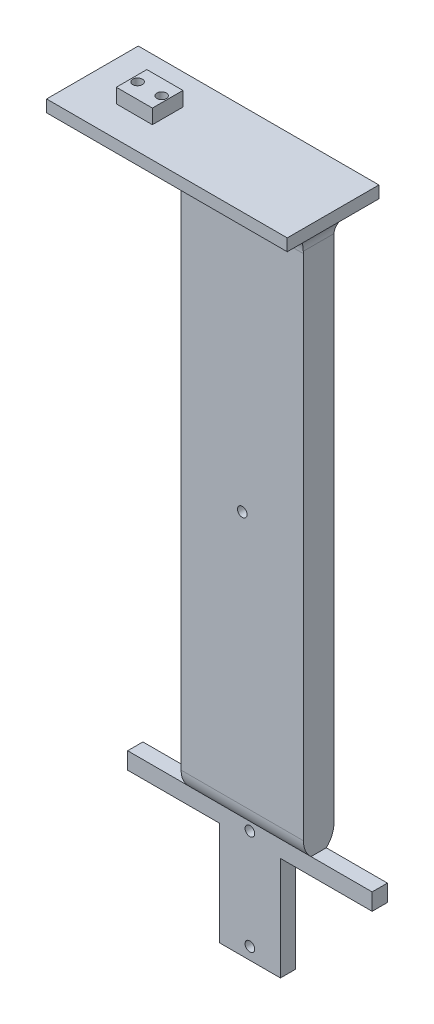
from build123d import *

# Parameters (mm, degrees)
BOSS_EXTRUDE1_DEPTH         = 5
BOSS_EXTRUDE2_DEPTH         = 6
TAP_DRILL_FOR_M4X0_7_TAP1_D = 3.3
SKETCH3_R                   = 2.000000000000003
CUT_EXTRUDE1_DEPTH          = 55.62510869554404
SKETCH12_R                  = 3.5
CUT_EXTRUDE2_DEPTH          = 3
BOSS_EXTRUDE3_DEPTH         = 228.6
SKETCH14_W                  = 101.6
SKETCH14_H                  = 6.35
BOSS_EXTRUDE4_DEPTH         = 7
FILLET1_R                   = 10
FILLET2_R                   = 10
FILLET3_R                   = 10
SKETCH15_R                  = 2.0000000000000067
CUT_EXTRUDE3_DEPTH          = 247.61238943937914
SKETCH16_W                  = 25.4
SKETCH16_H                  = 6.35
BOSS_EXTRUDE5_DEPTH         = 43.038
SKETCH17_R                  = 2.0000000000000036
CUT_EXTRUDE4_DEPTH          = 289.00945413128363
SKETCH18_R                  = 2.0000000000000036
CUT_EXTRUDE5_DEPTH          = 289.2718422669824


with BuildPart() as part:
    # Sketch1 → Boss-Extrude1 (new body)
    with BuildSketch(Plane(origin=(0, 0, 0), x_dir=(1, 0, 0), z_dir=(0, 1, 0))):
        Polygon((-49.99999999999999, 19.050000000000004), (50.00000000000001, 19.050000000000004), (50.000000000000014, -19.049999999999997), (-49.99999999999999, -19.049999999999997), align=None)
    extrude(amount=BOSS_EXTRUDE1_DEPTH)

    # Sketch2 → Boss-Extrude2 (add)
    with BuildSketch(Plane(origin=(0, 5, 0), x_dir=(1, 0, 0), z_dir=(0, 1, 0))):
        Polygon((-33.73664574389268, 6.349999999999993), (-18.736645743892684, 6.349999999999995), (-18.73664574389268, -6.350000000000003), (-33.73664574389268, -6.350000000000006), align=None)
    extrude(amount=BOSS_EXTRUDE2_DEPTH)

    # Tap Drill for M4x0.7 Tap1 (through all)
    with Locations(Plane(origin=(0, 11, 0), x_dir=(1, 0, 0), z_dir=(0, 1, 0))):
        with Locations((-31.236645744, 0), (-21.236645744, 0)):
            Hole(TAP_DRILL_FOR_M4X0_7_TAP1_D / 2)

    # Sketch3 → Cut-Extrude1 (cut, through all)
    with BuildSketch(Plane(origin=(0, 11, 0), x_dir=(1, 0, 0), z_dir=(0, 1, 0))):
        with Locations(Location((-21.236645743892684, 0, 0), (0, 0, 270))):
            Circle(SKETCH3_R)
        with Locations(Location((-31.23664574389268, 0, 0), (0, 0, 270))):
            Circle(SKETCH3_R)
    extrude(amount=-CUT_EXTRUDE1_DEPTH, mode=Mode.SUBTRACT)

    # Sketch12 → Cut-Extrude2 (cut)
    with BuildSketch(Plane.XZ):
        with Locations(Location((-31.23664574389268, 0, 0), (0, 0, 270))):
            Circle(SKETCH12_R)
        with Locations(Location((-21.236645743892684, 0, 0), (0, 0, 270))):
            Circle(SKETCH12_R)
    extrude(amount=-CUT_EXTRUDE2_DEPTH, mode=Mode.SUBTRACT)

    # Sketch13 → Boss-Extrude3 (add)
    with BuildSketch(Plane.XZ):
        Polygon((-6.799999999999993, 6.349999999999998), (44.00000000000001, 6.349999999999998), (44.00000000000001, -6.350000000000001), (-6.799999999999991, -6.350000000000001), align=None)
    extrude(amount=BOSS_EXTRUDE3_DEPTH)

    # Sketch14 → Boss-Extrude4 (add)
    with BuildSketch(Plane.XZ.offset(228.6)):
        with Locations((18.60000000000002, 2.89e-15)):
            Rectangle(SKETCH14_W, SKETCH14_H)
    extrude(amount=BOSS_EXTRUDE4_DEPTH)

    # Fillet1
    # the kernel refuses this fillet: 10 mm, written as the material it takes off along each edge
    with BuildSketch(Plane(origin=(62.27213982406002, -228.6, -6.350000000000001), x_dir=(0, 1, 0), z_dir=(-1, 0, 0))) as fillet1_piece_1:
        with BuildLine():
            CenterArc((7.308855929624002, -10), FILLET1_R, 90, 46.9606878980301)
            Line((0, -3.1750000000000007), (-0.14617711859247606, -3.038500000000001))
            ThreePointArc((-0.14617711859247606, -3.038500000000001), (-0.19999999999998863, -1.5875000000000004), (-0.19999999999998863, 0))
            Line((-0.19999999999998863, 0), (0, 0.20000000000000018))
            Line((0, 0.20000000000000018), (7.308855929624002, 0.20000000000000018))
            Line((7.308855929624002, 0.20000000000000018), (7.308855929624002, 0))
        make_face()
    extrude(amount=87.34427964812001, mode=Mode.SUBTRACT)

    # Fillet2
    # the kernel refuses this fillet: 10 mm, written as the material it takes off along each edge
    with BuildSketch(Plane(origin=(-25.07213982406, -228.6, 6.349999999999998), x_dir=(0, 1, 0), z_dir=(1, 0, 0))) as fillet2_piece_1:
        with BuildLine():
            CenterArc((7.308855929624002, -10), FILLET2_R, 90, 46.9606878980301)
            Line((0, -3.1749999999999954), (-0.14617711859247606, -3.038499999999995))
            ThreePointArc((-0.14617711859247606, -3.038499999999995), (-0.19999999999998863, -1.5874999999999977), (-0.19999999999998863, 0))
            Line((-0.19999999999998863, 0), (0, 0.20000000000000018))
            Line((0, 0.20000000000000018), (7.308855929624002, 0.20000000000000018))
            Line((7.308855929624002, 0.20000000000000018), (7.308855929624002, 0))
        make_face()
    extrude(amount=87.34427964812001, mode=Mode.SUBTRACT)

    # Fillet3
    # the kernel refuses this fillet: 10 mm, written as the material it adds along each edge
    with BuildSketch(Plane(origin=(44.00000000000001, 0, 6.349999999999998), x_dir=(1, 0, 0), z_dir=(0, 0, -1))) as fillet3_piece_1:
        with BuildLine():
            CenterArc((10, 9.165151389911683), FILLET3_R, 180, 66.42182152179822)
            Line((0, 9.165151389911683), (-0.20000000000000284, 9.165151389911683))
            Line((-0.20000000000000284, 9.165151389911683), (-0.20000000000000284, 0))
            Line((-0.20000000000000284, 0), (0, -0.2))
            ThreePointArc((0, -0.2), (3.000000000000007, -0.2), (5.920000000000009, -0.18330302779823368))
            Line((5.920000000000009, -0.18330302779823368), (6.000000000000007, 0))
        make_face()
    extrude(amount=12.7)
    with BuildSketch(Plane(origin=(-6.799999999999993, 0, 6.349999999999998), x_dir=(0, 0, 1), z_dir=(1, 0, 0))) as fillet3_piece_2:
        with BuildLine():
            CenterArc((FILLET3_R, FILLET3_R), FILLET3_R, 180, 90)
            Line((-3.55e-15, FILLET3_R), (-FILLET3_R * 0.02, FILLET3_R))
            Line((-FILLET3_R * 0.02, FILLET3_R), (-FILLET3_R * 0.02, -FILLET3_R * 0.02))
            Line((-FILLET3_R * 0.02, -FILLET3_R * 0.02), (FILLET3_R, -FILLET3_R * 0.02))
            Line((FILLET3_R, -FILLET3_R * 0.02), (FILLET3_R, 0))
        make_face()
    extrude(amount=50.8)
    with BuildSketch(Plane(origin=(-6.799999999999991, 0, -6.350000000000001), x_dir=(-1, 0, -1.4e-16), z_dir=(-1.4e-16, 0, 1))) as fillet3_piece_3:
        with BuildLine():
            CenterArc((FILLET3_R, FILLET3_R), FILLET3_R, 180, 90)
            Line((-8.9e-16, FILLET3_R), (-FILLET3_R * 0.02, FILLET3_R))
            Line((-FILLET3_R * 0.02, FILLET3_R), (-FILLET3_R * 0.02, -FILLET3_R * 0.02))
            Line((-FILLET3_R * 0.02, -FILLET3_R * 0.02), (FILLET3_R, -FILLET3_R * 0.02))
            Line((FILLET3_R, -FILLET3_R * 0.02), (FILLET3_R, 0))
        make_face()
    extrude(amount=12.7)
    with BuildSketch(Plane(origin=(44.00000000000001, 0, -6.350000000000001), x_dir=(0, 0, -1), z_dir=(-1, 0, 0))) as fillet3_piece_4:
        with BuildLine():
            CenterArc((FILLET3_R, FILLET3_R), FILLET3_R, 180, 90)
            Line((0, FILLET3_R), (-FILLET3_R * 0.02, FILLET3_R))
            Line((-FILLET3_R * 0.02, FILLET3_R), (-FILLET3_R * 0.02, -FILLET3_R * 0.02))
            Line((-FILLET3_R * 0.02, -FILLET3_R * 0.02), (FILLET3_R, -FILLET3_R * 0.02))
            Line((FILLET3_R, -FILLET3_R * 0.02), (FILLET3_R, 0))
        make_face()
    extrude(amount=50.8)
    with BuildSketch(Plane(origin=(44.00000000000001, 0, 29.262878474779207), x_dir=(1, 0, 0), z_dir=(0, 0, -1))) as fillet3_piece_5a_section:
        with BuildLine():
            CenterArc((10, 9.165151389911683), FILLET3_R, 180, 66.42182152179822)
            Line((0, 9.165151389911683), (-0.20000000000000284, 9.165151389911683))
            Line((-0.20000000000000284, 9.165151389911683), (-0.20000000000000284, 0))
            Line((-0.20000000000000284, 0), (0, -0.2))
            ThreePointArc((0, -0.2), (3.000000000000007, -0.2), (5.920000000000009, -0.18330302779823368))
            Line((5.920000000000009, -0.18330302779823368), (6.000000000000007, 0))
        make_face()
    fillet3_piece_5a = extrude(amount=35.61287847477921, mode=Mode.PRIVATE)
    fillet3_piece_5a = split(fillet3_piece_5a, bisect_by=Plane(origin=(45.551632877410285, -2.2318754420498643, 19.049999999999997), z_dir=(0, 0, -1)), keep=Keep.TOP, mode=Mode.PRIVATE)
    fillet3_piece_5a = split(fillet3_piece_5a, bisect_by=Plane(origin=(45.551632877410285, -2.2318754420498643, 6.349999999999998), z_dir=(0, 0, 1)), keep=Keep.TOP, mode=Mode.PRIVATE)
    with BuildSketch(Plane(origin=(-6.799999999999993, 0, 6.349999999999998), x_dir=(0, 0, 1), z_dir=(1, 0, 0))) as fillet3_piece_5b_section:
        with BuildLine():
            CenterArc((FILLET3_R, FILLET3_R), FILLET3_R, 180, 90)
            Line((-3.55e-15, FILLET3_R), (-FILLET3_R * 0.02, FILLET3_R))
            Line((-FILLET3_R * 0.02, FILLET3_R), (-FILLET3_R * 0.02, -FILLET3_R * 0.02))
            Line((-FILLET3_R * 0.02, -FILLET3_R * 0.02), (FILLET3_R, -FILLET3_R * 0.02))
            Line((FILLET3_R, -FILLET3_R * 0.02), (FILLET3_R, 0))
        make_face()
    fillet3_piece_5b = extrude(amount=75.8, mode=Mode.PRIVATE)
    fillet3_piece_5b = split(fillet3_piece_5b, bisect_by=Plane(origin=(50.000000000000014, -2.2639511426682537, 8.613951142668249), z_dir=(-1, 0, 1.9e-16)), keep=Keep.TOP, mode=Mode.PRIVATE)
    fillet3_piece_5b = split(fillet3_piece_5b, bisect_by=Plane(origin=(44.00000000000001, -2.2639511426682537, 8.613951142668249), z_dir=(1, 0, 0)), keep=Keep.TOP, mode=Mode.PRIVATE)
    fillet3_piece_5 = fillet3_piece_5a & fillet3_piece_5b
    add(fillet3_piece_5)
    with BuildSketch(Plane(origin=(69, 0, -6.350000000000001), x_dir=(0, 0, -1), z_dir=(-1, 0, 0))) as fillet3_piece_6a_section:
        with BuildLine():
            CenterArc((FILLET3_R, FILLET3_R), FILLET3_R, 180, 90)
            Line((0, FILLET3_R), (-FILLET3_R * 0.02, FILLET3_R))
            Line((-FILLET3_R * 0.02, FILLET3_R), (-FILLET3_R * 0.02, -FILLET3_R * 0.02))
            Line((-FILLET3_R * 0.02, -FILLET3_R * 0.02), (FILLET3_R, -FILLET3_R * 0.02))
            Line((FILLET3_R, -FILLET3_R * 0.02), (FILLET3_R, 0))
        make_face()
    fillet3_piece_6a = extrude(amount=75.79999999999998, mode=Mode.PRIVATE)
    fillet3_piece_6a = split(fillet3_piece_6a, bisect_by=Plane(origin=(50.00000000000001, -2.2639511426682555, -8.613951142668254), z_dir=(-1, 0, 1.9e-16)), keep=Keep.TOP, mode=Mode.PRIVATE)
    fillet3_piece_6a = split(fillet3_piece_6a, bisect_by=Plane(origin=(44.00000000000001, -2.2639511426682555, -8.613951142668252), z_dir=(1, 0, 0)), keep=Keep.TOP, mode=Mode.PRIVATE)
    with BuildSketch(Plane(origin=(44.00000000000001, 0, 6.349999999999998), x_dir=(1, 0, 0), z_dir=(0, 0, -1))) as fillet3_piece_6b_section:
        with BuildLine():
            CenterArc((10, 9.165151389911683), FILLET3_R, 180, 66.42182152179822)
            Line((0, 9.165151389911683), (-0.20000000000000284, 9.165151389911683))
            Line((-0.20000000000000284, 9.165151389911683), (-0.20000000000000284, 0))
            Line((-0.20000000000000284, 0), (0, -0.2))
            ThreePointArc((0, -0.2), (3.000000000000007, -0.2), (5.920000000000009, -0.18330302779823368))
            Line((5.920000000000009, -0.18330302779823368), (6.000000000000007, 0))
        make_face()
    fillet3_piece_6b = extrude(amount=35.61287847477921, mode=Mode.PRIVATE)
    fillet3_piece_6b = split(fillet3_piece_6b, bisect_by=Plane(origin=(45.55163287741028, -2.2318754420498657, -19.050000000000004), z_dir=(0, 0, 1)), keep=Keep.TOP, mode=Mode.PRIVATE)
    fillet3_piece_6b = split(fillet3_piece_6b, bisect_by=Plane(origin=(45.551632877410285, -2.2318754420498657, -6.350000000000001), z_dir=(0, 0, -1)), keep=Keep.TOP, mode=Mode.PRIVATE)
    fillet3_piece_6 = fillet3_piece_6a & fillet3_piece_6b
    add(fillet3_piece_6)
    with BuildSketch(Plane(origin=(-6.799999999999991, 0, -6.350000000000001), x_dir=(-1, 0, -1.4e-16), z_dir=(-1.4e-16, 0, 1))) as fillet3_piece_7a_section:
        with BuildLine():
            CenterArc((FILLET3_R, FILLET3_R), FILLET3_R, 180, 90)
            Line((-8.9e-16, FILLET3_R), (-FILLET3_R * 0.02, FILLET3_R))
            Line((-FILLET3_R * 0.02, FILLET3_R), (-FILLET3_R * 0.02, -FILLET3_R * 0.02))
            Line((-FILLET3_R * 0.02, -FILLET3_R * 0.02), (FILLET3_R, -FILLET3_R * 0.02))
            Line((FILLET3_R, -FILLET3_R * 0.02), (FILLET3_R, 0))
        make_face()
    fillet3_piece_7a = extrude(amount=37.699999999999996, mode=Mode.PRIVATE)
    fillet3_piece_7a = split(fillet3_piece_7a, bisect_by=Plane(origin=(-9.063951142668245, -2.2639511426682555, 19.049999999999997), z_dir=(0, 0, -1)), keep=Keep.TOP, mode=Mode.PRIVATE)
    fillet3_piece_7a = split(fillet3_piece_7a, bisect_by=Plane(origin=(-9.063951142668246, -2.2639511426682555, 6.349999999999998), z_dir=(0, 0, 1)), keep=Keep.TOP, mode=Mode.PRIVATE)
    with BuildSketch(Plane(origin=(-31.79999999999999, 0, 6.349999999999998), x_dir=(0, 0, 1), z_dir=(1, 0, 0))) as fillet3_piece_7b_section:
        with BuildLine():
            CenterArc((FILLET3_R, FILLET3_R), FILLET3_R, 180, 90)
            Line((-3.55e-15, FILLET3_R), (-FILLET3_R * 0.02, FILLET3_R))
            Line((-FILLET3_R * 0.02, FILLET3_R), (-FILLET3_R * 0.02, -FILLET3_R * 0.02))
            Line((-FILLET3_R * 0.02, -FILLET3_R * 0.02), (FILLET3_R, -FILLET3_R * 0.02))
            Line((FILLET3_R, -FILLET3_R * 0.02), (FILLET3_R, 0))
        make_face()
    fillet3_piece_7b = extrude(amount=75.8, mode=Mode.PRIVATE)
    fillet3_piece_7b = split(fillet3_piece_7b, bisect_by=Plane(origin=(-6.799999999999993, -2.263951142668253, 8.613951142668249), z_dir=(-1, 0, -1.4e-16)), keep=Keep.TOP, mode=Mode.PRIVATE)
    fillet3_piece_7 = fillet3_piece_7a & fillet3_piece_7b
    add(fillet3_piece_7)
    with BuildSketch(Plane(origin=(-6.799999999999987, 0, -31.349999999999998), x_dir=(-1, 0, -1.4e-16), z_dir=(-1.4e-16, 0, 1))) as fillet3_piece_8a_section:
        with BuildLine():
            CenterArc((FILLET3_R, FILLET3_R), FILLET3_R, 180, 90)
            Line((-8.9e-16, FILLET3_R), (-FILLET3_R * 0.02, FILLET3_R))
            Line((-FILLET3_R * 0.02, FILLET3_R), (-FILLET3_R * 0.02, -FILLET3_R * 0.02))
            Line((-FILLET3_R * 0.02, -FILLET3_R * 0.02), (FILLET3_R, -FILLET3_R * 0.02))
            Line((FILLET3_R, -FILLET3_R * 0.02), (FILLET3_R, 0))
        make_face()
    fillet3_piece_8a = extrude(amount=37.699999999999996, mode=Mode.PRIVATE)
    fillet3_piece_8a = split(fillet3_piece_8a, bisect_by=Plane(origin=(-9.063951142668245, -2.2639511426682524, -19.050000000000004), z_dir=(0, 0, 1)), keep=Keep.TOP, mode=Mode.PRIVATE)
    fillet3_piece_8a = split(fillet3_piece_8a, bisect_by=Plane(origin=(-9.063951142668245, -2.2639511426682524, -6.350000000000001), z_dir=(0, 0, -1)), keep=Keep.TOP, mode=Mode.PRIVATE)
    with BuildSketch(Plane(origin=(44.00000000000001, 0, -6.350000000000001), x_dir=(0, 0, -1), z_dir=(-1, 0, 0))) as fillet3_piece_8b_section:
        with BuildLine():
            CenterArc((FILLET3_R, FILLET3_R), FILLET3_R, 180, 90)
            Line((0, FILLET3_R), (-FILLET3_R * 0.02, FILLET3_R))
            Line((-FILLET3_R * 0.02, FILLET3_R), (-FILLET3_R * 0.02, -FILLET3_R * 0.02))
            Line((-FILLET3_R * 0.02, -FILLET3_R * 0.02), (FILLET3_R, -FILLET3_R * 0.02))
            Line((FILLET3_R, -FILLET3_R * 0.02), (FILLET3_R, 0))
        make_face()
    fillet3_piece_8b = extrude(amount=75.8, mode=Mode.PRIVATE)
    fillet3_piece_8b = split(fillet3_piece_8b, bisect_by=Plane(origin=(-6.799999999999991, -2.263951142668254, -8.613951142668252), z_dir=(-1, 0, -1.4e-16)), keep=Keep.TOP, mode=Mode.PRIVATE)
    fillet3_piece_8 = fillet3_piece_8a & fillet3_piece_8b
    add(fillet3_piece_8)

    # Sketch15 → Cut-Extrude3 (cut, through all)
    with BuildSketch(Plane(origin=(0, 0, -3.174999999999997), x_dir=(-1, 0, 0), z_dir=(0, 0, -1))):
        with Locations((-18.600000000000023, -232.09999999999997)):
            Circle(SKETCH15_R)
    extrude(amount=-CUT_EXTRUDE3_DEPTH, mode=Mode.SUBTRACT)

    # Sketch16 → Boss-Extrude5 (add)
    with BuildSketch(Plane.XZ.offset(235.6)):
        with Locations((18.6, 2.89e-15)):
            Rectangle(SKETCH16_W, SKETCH16_H)
    extrude(amount=BOSS_EXTRUDE5_DEPTH)

    # Sketch17 → Cut-Extrude4 (cut, through all)
    with BuildSketch(Plane(origin=(0, 0, -3.174999999999997), x_dir=(-1, 0, 0), z_dir=(0, 0, -1))):
        with Locations((-18.599999999999998, -273.638)):
            Circle(SKETCH17_R)
    extrude(amount=-CUT_EXTRUDE4_DEPTH, mode=Mode.SUBTRACT)

    # Sketch18 → Cut-Extrude5 (cut, through all)
    with BuildSketch(Plane.XY.offset(6.349999999999998)):
        with Locations((18.599999999999984, -115.64557203518808)):
            Circle(SKETCH18_R)
    extrude(amount=-CUT_EXTRUDE5_DEPTH, mode=Mode.SUBTRACT)


solid = part.part
